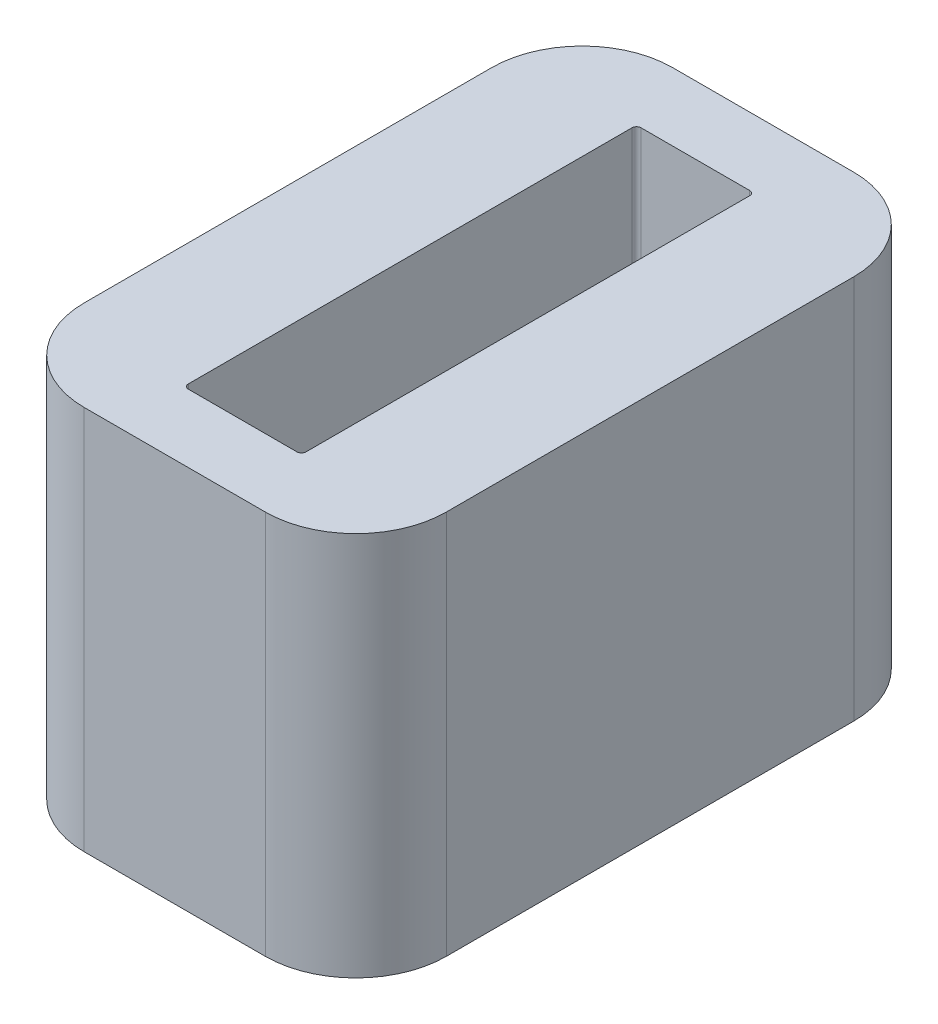
from build123d import *

# Parameters (mm, degrees)
COIL_START = -0.7
SKETCH1_W  = 2.6
SKETCH1_H  = 10
COIL_DEPTH = 8.5
FILLET1_R  = 0.1


with BuildPart() as part:
    # Sketch1 → Coil (new body)
    with BuildSketch(Plane(origin=(0, 97.279475289, 0), x_dir=(1, 0, 0), z_dir=(0, 1, 0)).offset(COIL_START)):
        with BuildLine():
            Line((87.072792821, 72.609367759), (91.072792821, 72.609367759))
            ThreePointArc((91.072792821, 72.609367759), (92.487006384, 73.195154196), (93.072792821, 74.609367759))
            Line((93.072792821, 74.609367759), (93.072792821, 83.609367759))
            ThreePointArc((93.072792821, 83.609367759), (92.487006384, 85.023581321), (91.072792821, 85.609367759))
            Line((91.072792821, 85.609367759), (87.072792821, 85.609367759))
            ThreePointArc((87.072792821, 85.609367759), (85.658579259, 85.023581321), (85.072792821, 83.609367759))
            Line((85.072792821, 83.609367759), (85.072792821, 74.609367759))
            ThreePointArc((85.072792821, 74.609367759), (85.658579259, 73.195154196), (87.072792821, 72.609367759))
        make_face()
        with Locations((89.072792821, 79.109367759)):
            Rectangle(SKETCH1_W, SKETCH1_H, mode=Mode.SUBTRACT)
    extrude(amount=-COIL_DEPTH)

    # Fillet1
    fillet1_edges = [part.edges().sort_by_distance(p)[0] for p in [
        (90.372792821, 92.329475289, -74.109367759),
        (87.772792821, 92.329475289, -74.109367759),
        (87.772792821, 92.329475289, -84.109367759),
        (90.372792821, 92.329475289, -84.109367759),
    ]]
    fillet(fillet1_edges, radius=FILLET1_R)


solid = part.part
